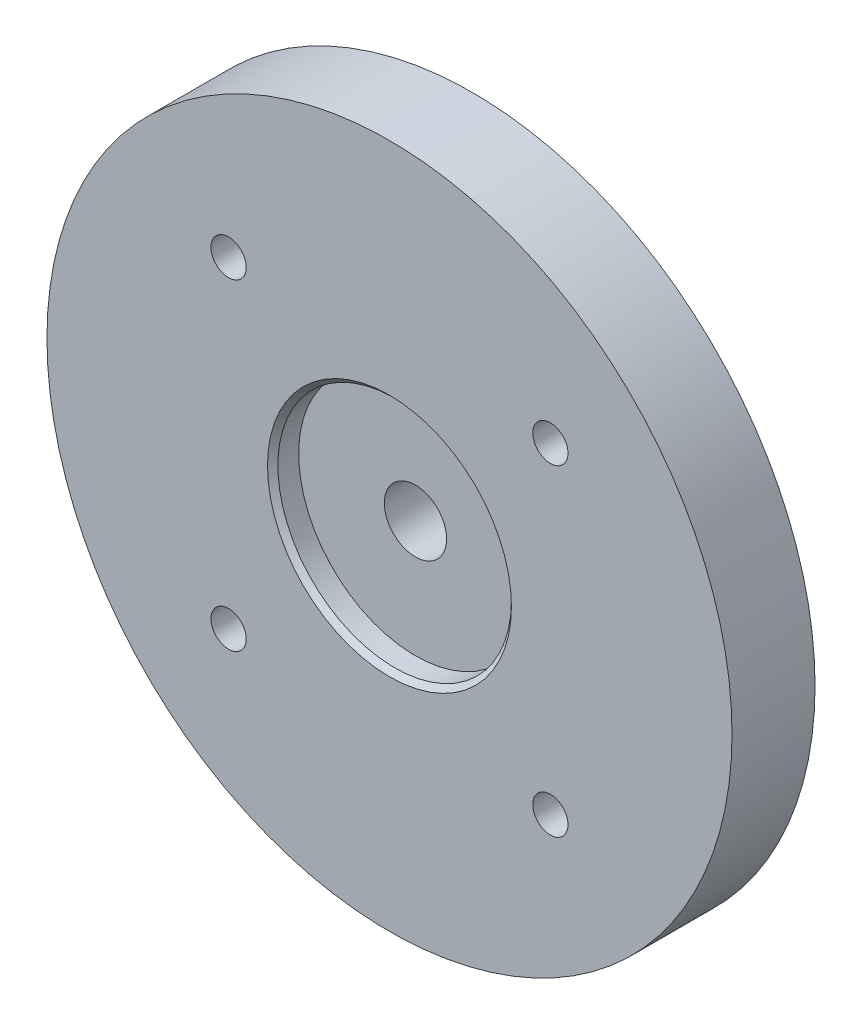
from build123d import *

# Parameters (mm, degrees)
SKETCH2_R               = 33
BOSS_EXTRUDE1_DEPTH     = 8
SKETCH6_R               = 10
BOSS_EXTRUDE2_DEPTH     = 2
CUT_EXTRUDE1_DEPTH      = 48.728398255
CUT_EXTRUDE1_DEPTH_BACK = 48.728398255
SKETCH3_R               = 1.7
SKETCH3_R_2             = 3
CUT_EXTRUDE2_DEPTH      = 48.349762407
CUT_EXTRUDE2_DEPTH_BACK = 2
SKETCH4_R               = 2.8
SKETCH5_R               = 2.1
CUT_EXTRUDE3_DEPTH      = 6
FILLET1_R               = 1
SKETCH7_R               = 11.25
CUT_EXTRUDE4_DEPTH      = 2.5
CHAMFER1_SIZE           = 0.5


with BuildPart() as part:
    # Sketch2 → Boss-Extrude1 (new body)
    with BuildSketch(Plane.XY):
        Circle(SKETCH2_R)
    extrude(amount=BOSS_EXTRUDE1_DEPTH)

    # Sketch6 → Boss-Extrude2 (add)
    with BuildSketch(Plane(origin=(0, 0, 0), x_dir=(-1, 0, 0), z_dir=(0, 0, -1))):
        Circle(SKETCH6_R)
    extrude(amount=BOSS_EXTRUDE2_DEPTH)

    # Sketch3 → Cut-Extrude1 (cut, two sides: drawn at the far end of the back side and taken through both)
    with BuildSketch(Plane.XY.offset(8).offset(-CUT_EXTRUDE1_DEPTH_BACK)):
        with Locations((-15.5, 15.5)):
            Circle(SKETCH3_R)
        with Locations((15.5, 15.5)):
            Circle(SKETCH3_R)
        with Locations((15.5, -15.5)):
            Circle(SKETCH3_R)
        with Locations((-15.5, -15.5)):
            Circle(SKETCH3_R)
        Circle(SKETCH3_R_2)
    extrude(amount=CUT_EXTRUDE1_DEPTH + CUT_EXTRUDE1_DEPTH_BACK, mode=Mode.SUBTRACT)

    # Sketch4 → Cut-Extrude2 (cut, two sides: drawn at the far end of the back side and taken through both)
    with BuildSketch(Plane(origin=(0, 0, 0), x_dir=(-1, 0, 0), z_dir=(0, 0, -1)).offset(-CUT_EXTRUDE2_DEPTH_BACK)):
        with Locations((-15.5, 15.5)):
            Circle(SKETCH4_R)
        with Locations((15.5, 15.5)):
            Circle(SKETCH4_R)
        with Locations((15.5, -15.5)):
            Circle(SKETCH4_R)
        with Locations((-15.5, -15.5)):
            Circle(SKETCH4_R)
    extrude(amount=CUT_EXTRUDE2_DEPTH + CUT_EXTRUDE2_DEPTH_BACK, mode=Mode.SUBTRACT)

    # Sketch5 → Cut-Extrude3 (cut)
    with BuildSketch(Plane(origin=(0, 0, 0), x_dir=(-1, 0, 0), z_dir=(0, 0, -1))):
        with Locations((0, 29.5)):
            Circle(SKETCH5_R)
        with Locations((29.5, 0)):
            Circle(SKETCH5_R)
        with Locations((0, -29.5)):
            Circle(SKETCH5_R)
        with Locations((-29.5, 0)):
            Circle(SKETCH5_R)
    extrude(amount=-CUT_EXTRUDE3_DEPTH, mode=Mode.SUBTRACT)

    # Fillet1
    fillet1_edges = [part.edges().sort_by_distance(p)[0] for p in [
        (10, 0, 0),
    ]]
    fillet(fillet1_edges, radius=FILLET1_R)

    # Sketch7 → Cut-Extrude4 (cut)
    with BuildSketch(Plane.XY.offset(8)):
        Circle(SKETCH7_R)
    extrude(amount=-CUT_EXTRUDE4_DEPTH, mode=Mode.SUBTRACT)

    # Chamfer1
    chamfer1_edges = [part.edges().sort_by_distance(p)[0] for p in [
        (-11.25, 0, 8),
    ]]
    chamfer(chamfer1_edges, length=CHAMFER1_SIZE)


solid = part.part
